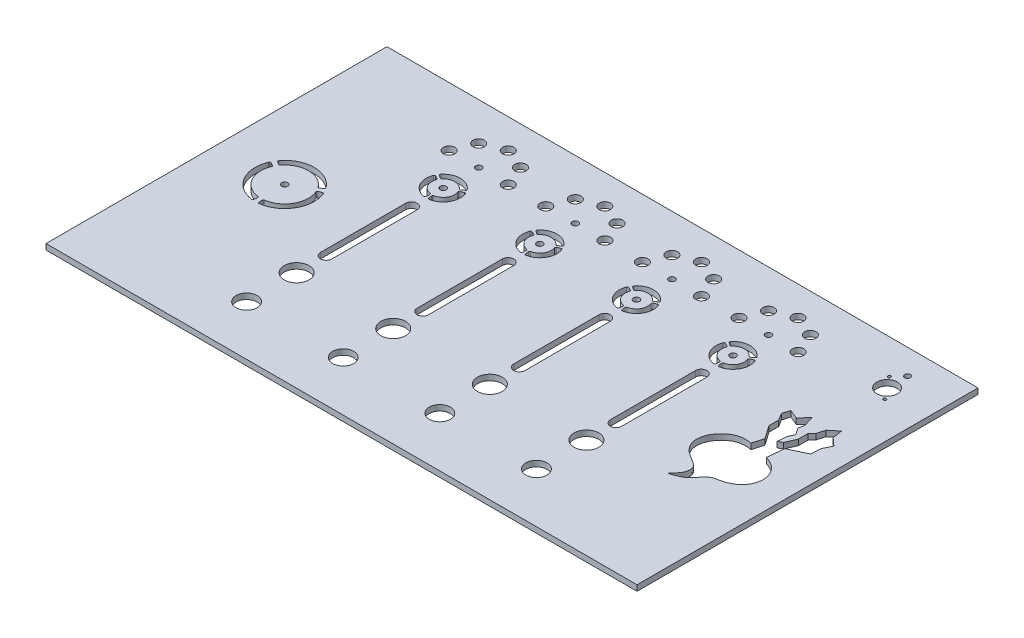
from build123d import *

# Parameters (mm, degrees)
SKETCH1_W           = 660.4
SKETCH1_H           = 381
BOSS_EXTRUDE1_DEPTH = 6.35
SKETCH2_R           = 11.811
SKETCH2_R_2         = 13.843
SKETCH2_R_3         = 3.429
SKETCH2_R_4         = 6.35
CUT_EXTRUDE1_DEPTH  = 382.264491528
CUT_EXTRUDE9_DEPTH  = 382.264491528
LPATTERN1_COUNT     = 4
LPATTERN1_PITCH     = 107.95
SKETCH5_R           = 3.429
CUT_EXTRUDE6_DEPTH  = 382.264491528
SKETCH6_R           = 11.43
SKETCH6_R_2         = 3.175
SKETCH6_R_3         = 1.651
CUT_EXTRUDE7_DEPTH  = 382.264491528
CUT_EXTRUDE8_DEPTH  = 382.264491528


with BuildPart() as part:
    # Sketch1 → Boss-Extrude1 (new body)
    with BuildSketch(Plane(origin=(0, 0, 0), x_dir=(1, 0, 0), z_dir=(0, 1, 0))):
        Rectangle(SKETCH1_W, SKETCH1_H)
    extrude(amount=BOSS_EXTRUDE1_DEPTH)

    # Sketch2 → Cut-Extrude1 (cut, through all)
    with BuildSketch(Plane(origin=(0, 6.35, 0), x_dir=(1, 0, 0), z_dir=(0, 1, 0))):
        with BuildLine():
            Line((-155.575, -45.72), (-155.575, 49.53))
            ThreePointArc((-155.575, 49.53), (-161.925, 55.88), (-168.275, 49.53))
            Line((-168.275, 49.53), (-168.275, -45.72))
            ThreePointArc((-168.275, -45.72), (-161.925, -52.07), (-155.575, -45.72))
        make_face()
        with Locations((-161.925, -134.62)):
            Circle(SKETCH2_R)
        with Locations((-161.925, -78.74)):
            Circle(SKETCH2_R_2)
        with Locations((-161.925, 85.09)):
            Circle(SKETCH2_R_3)
        with Locations((-161.925, 124.714)):
            Circle(SKETCH2_R_3)
        with Locations((-194.945, 124.714)):
            Circle(SKETCH2_R_4)
        with Locations((-185.273665915, 148.062665915)):
            Circle(SKETCH2_R_4)
        with Locations((-161.925, 157.734)):
            Circle(SKETCH2_R_4)
        with Locations((-138.576334085, 148.062665915)):
            Circle(SKETCH2_R_4)
        with Locations((-128.905, 124.714)):
            Circle(SKETCH2_R_4)
    cut_extrude1 = extrude(amount=-CUT_EXTRUDE1_DEPTH, mode=Mode.SUBTRACT)

    # Sketch10 → Cut-Extrude9 (cut, through all)
    with BuildSketch(Plane(origin=(0, 6.35, 0), x_dir=(1, 0, 0), z_dir=(0, 1, 0))):
        with BuildLine():
            Line((-176.452321439, 95.262139982), (-173.321168538, 93.069683117))
            ThreePointArc((-173.321168538, 93.069683117), (-172.429330902, 92.850561141), (-171.622933149, 93.290005649))
            ThreePointArc((-171.622933149, 93.290005649), (-161.925, 97.79), (-152.227066851, 93.290005649))
            ThreePointArc((-152.227066851, 93.290005649), (-151.420669098, 92.850561141), (-150.528831462, 93.069683117))
            Line((-150.528831462, 93.069683117), (-147.397678561, 95.262139982))
            ThreePointArc((-147.397678561, 95.262139982), (-146.868332488, 96.12676738), (-147.140486395, 97.103353298))
            ThreePointArc((-147.140486395, 97.103353298), (-161.925, 104.14), (-176.709513605, 97.103353298))
            ThreePointArc((-176.709513605, 97.103353298), (-176.981667512, 96.12676738), (-176.452321439, 95.262139982))
        make_face()
        with BuildLine():
            Line((-145.852007646, 92.584959424), (-149.316307437, 90.969529901))
            ThreePointArc((-149.316307437, 90.969529901), (-149.951991453, 90.30673684), (-149.974620223, 89.388653647))
            ThreePointArc((-149.974620223, 89.388653647), (-150.926477372, 78.74), (-159.672553372, 72.591340704))
            ThreePointArc((-159.672553372, 72.591340704), (-160.456322355, 72.112702019), (-160.712475975, 71.230786982))
            Line((-160.712475975, 71.230786982), (-160.379329085, 67.422900594))
            ThreePointArc((-160.379329085, 67.422900594), (-159.895212829, 66.532159749), (-158.913387662, 66.279558986))
            ThreePointArc((-158.913387662, 66.279558986), (-145.427216058, 75.565), (-144.128874057, 91.887087716))
            ThreePointArc((-144.128874057, 91.887087716), (-144.838545317, 92.611072871), (-145.852007646, 92.584959424))
        make_face()
        with BuildLine():
            Line((-163.470670915, 67.422900594), (-163.137524025, 71.230786982))
            ThreePointArc((-163.137524025, 71.230786982), (-163.393677645, 72.112702019), (-164.177446628, 72.591340704))
            ThreePointArc((-164.177446628, 72.591340704), (-172.923522628, 78.74), (-173.875379777, 89.388653647))
            ThreePointArc((-173.875379777, 89.388653647), (-173.898008547, 90.30673684), (-174.533692563, 90.969529901))
            Line((-174.533692563, 90.969529901), (-177.997992354, 92.584959424))
            ThreePointArc((-177.997992354, 92.584959424), (-179.011454683, 92.611072871), (-179.721125943, 91.887087716))
            ThreePointArc((-179.721125943, 91.887087716), (-178.422783942, 75.565), (-164.936612338, 66.279558986))
            ThreePointArc((-164.936612338, 66.279558986), (-163.954787171, 66.532159749), (-163.470670915, 67.422900594))
        make_face()
    cut_extrude9 = extrude(amount=-CUT_EXTRUDE9_DEPTH, mode=Mode.SUBTRACT)

    # LPattern1: Cut-Extrude1, Cut-Extrude9 ×4
    with Locations(*[(i * LPATTERN1_PITCH, 0, 0) for i in range(1, LPATTERN1_COUNT)]):
        add(cut_extrude1, mode=Mode.SUBTRACT)
        add(cut_extrude9, mode=Mode.SUBTRACT)

    # Sketch5 → Cut-Extrude6 (cut, through all)
    with BuildSketch(Plane(origin=(0, 6.35, 0), x_dir=(1, 0, 0), z_dir=(0, 1, 0))):
        with BuildLine():
            ThreePointArc((-280.269173362, 20.006272288), (-280.513687667, 19.041330343), (-279.987262615, 18.19647718))
            Line((-279.987262615, 18.19647718), (-276.863452185, 16.00916157))
            ThreePointArc((-276.863452185, 16.00916157), (-275.942966399, 15.794088628), (-275.128873288, 16.27450809))
            ThreePointArc((-275.128873288, 16.27450809), (-254, 26.67), (-232.871126712, 16.27450809))
            ThreePointArc((-232.871126712, 16.27450809), (-232.057033601, 15.794088628), (-231.136547815, 16.00916157))
            Line((-231.136547815, 16.00916157), (-228.012737385, 18.19647718))
            ThreePointArc((-228.012737385, 18.19647718), (-227.486312333, 19.041330343), (-227.730826638, 20.006272288))
            ThreePointArc((-227.730826638, 20.006272288), (-254, 33.02), (-280.269173362, 20.006272288))
        make_face()
        with BuildLine():
            ThreePointArc((-223.539473283, 12.746635324), (-224.252880367, 13.440861896), (-225.247757195, 13.407391009))
            Line((-225.247757195, 13.407391009), (-228.703933295, 11.795749626))
            ThreePointArc((-228.703933295, 11.795749626), (-229.350434819, 11.106122022), (-229.341425916, 10.160886976))
            ThreePointArc((-229.341425916, 10.160886976), (-230.903102481, -13.335), (-250.470299204, -26.435395066))
            ThreePointArc((-250.470299204, -26.435395066), (-251.293401218, -26.90021065), (-251.56738548, -27.804911196))
            Line((-251.56738548, -27.804911196), (-251.23501981, -31.60386819))
            ThreePointArc((-251.23501981, -31.60386819), (-250.766568035, -32.482192239), (-249.808646645, -32.752907612))
            ThreePointArc((-249.808646645, -32.752907612), (-225.403841167, -16.51), (-223.539473283, 12.746635324))
        make_face()
        with BuildLine():
            ThreePointArc((-258.191353355, -32.752907612), (-257.233431965, -32.482192239), (-256.76498019, -31.60386819))
            Line((-256.76498019, -31.60386819), (-256.43261452, -27.804911196))
            ThreePointArc((-256.43261452, -27.804911196), (-256.706598782, -26.90021065), (-257.529700796, -26.435395066))
            ThreePointArc((-257.529700796, -26.435395066), (-277.096897519, -13.335), (-278.658574084, 10.160886976))
            ThreePointArc((-278.658574084, 10.160886976), (-278.649565181, 11.106122022), (-279.296066705, 11.795749626))
            Line((-279.296066705, 11.795749626), (-282.752242805, 13.407391009))
            ThreePointArc((-282.752242805, 13.407391009), (-283.747119633, 13.440861896), (-284.460526717, 12.746635324))
            ThreePointArc((-284.460526717, 12.746635324), (-282.596158833, -16.51), (-258.191353355, -32.752907612))
        make_face()
        with Locations((-254, 0)):
            Circle(SKETCH5_R)
    extrude(amount=-CUT_EXTRUDE6_DEPTH, mode=Mode.SUBTRACT)

    # Sketch6 → Cut-Extrude7 (cut, through all)
    with BuildSketch(Plane(origin=(0, 6.35, 0), x_dir=(1, 0, 0), z_dir=(0, 1, 0))):
        with Locations((279.4, 139.7)):
            Circle(SKETCH6_R)
        with Locations((279.4, 162.56)):
            Circle(SKETCH6_R_2)
        with Locations((269.748, 151.892)):
            Circle(SKETCH6_R_3)
        with Locations((289.052, 127.508)):
            Circle(SKETCH6_R_3)
    extrude(amount=-CUT_EXTRUDE7_DEPTH, mode=Mode.SUBTRACT)

    # Sketch7 → Cut-Extrude8 (cut, through all)
    with BuildSketch(Plane(origin=(0, 6.35, 0), x_dir=(1, 0, 0), z_dir=(0, 1, 0))):
        with BuildLine():
            add(Edge.make_bspline(
                [(256.813340096, 10.19357107), (252.300720713, 11.010812626), (230.846690407, 12.361272455), (209.075137271, -25.361903105), (250.495869654, -43.389553116), (247.397843991, -60.097900354), (232.687395821, -67.827582804), (257.589625428, -59.874457216), (263.3919573, -45.043066921), (297.850707717, -40.871810084), (303.915902814, -14.965786826), (289.347080058, 1.069283757), (282.875974473, 3.885326319), (279.247049249, 5.033611019)],
                knots=[0.041536762, 0.041536762, 0.041536762, 0.041536762, 0.112636564, 0.317898828, 0.358519244, 0.40149926, 0.459605453, 0.498799105, 0.539956935, 0.572148195, 0.793093537, 0.838640534, 0.897634188, 0.897634188, 0.897634188, 0.897634188], degree=3))
            Line((279.247049249, 5.033611019), (281.096400017, 23.834243609))
            Line((281.096400017, 23.834243609), (300.487590385, 32.923251233))
            Line((300.487590385, 32.923251233), (301.27566465, 43.930122851))
            Line((301.27566465, 43.930122851), (305.945246549, 53.686213603))
            Line((305.945246549, 53.686213603), (297.323354159, 61.510719409))
            Line((297.323354159, 61.510719409), (295.754119504, 72.495361996))
            Line((295.754119504, 72.495361996), (286.279665621, 64.796047212))
            Line((286.279665621, 64.796047212), (283.682840893, 55.958051847))
            Line((283.682840893, 55.958051847), (279.405808655, 51.079849127))
            Line((279.405808655, 51.079849127), (279.405808655, 40.739678245))
            Line((279.405808655, 40.739678245), (274.425568733, 29.170908636))
            Line((274.425568733, 29.170908636), (269.777977359, 26.502576122))
            Line((269.777977359, 26.502576122), (270.673226136, 37.259291567))
            Line((270.673226136, 37.259291567), (273.591714823, 43.346425114))
            Line((273.591714823, 43.346425114), (268.421820578, 51.079849127))
            Line((268.421820578, 51.079849127), (269.777977359, 56.927253238))
            Line((269.777977359, 56.927253238), (266.330969718, 69.160738354))
            Line((266.330969718, 69.160738354), (257.602101948, 59.843407588))
            Line((257.602101948, 59.843407588), (247.509969314, 64.188727532))
            Line((247.509969314, 64.188727532), (245.091590342, 55.958051847))
            Line((245.091590342, 55.958051847), (249.928348287, 48.017105967))
            Line((249.928348287, 48.017105967), (249.928348287, 37.259291567))
            Line((249.928348287, 37.259291567), (260.215683353, 22.428440592))
            Line((260.215683353, 22.428440592), (256.813340096, 10.19357107))
        make_face()
    extrude(amount=-CUT_EXTRUDE8_DEPTH, mode=Mode.SUBTRACT)


solid = part.part
